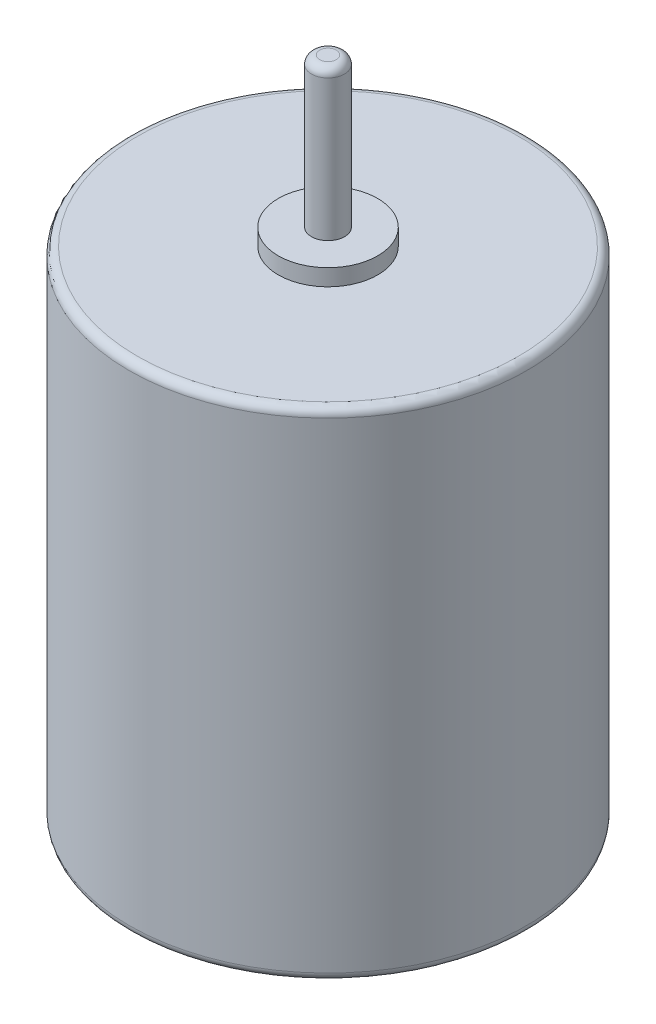
from build123d import *

# Parameters (mm, degrees)
SKETCH1_R                = 12
MOTOR_HOUSING_DEPTH      = 30
SKETCH2_R                = 3
MOTOR_FRONT_NIPPLE_DEPTH = 1
SKETCH4_R                = 1
FRONT_AXLE_DEPTH         = 9
FILLET1_R                = 0.5
FILLET2_R                = 0.5


with BuildPart() as part:
    # Sketch1 → Motor housing (new body)
    with BuildSketch(Plane(origin=(0, 0, 0), x_dir=(1, 0, 0), z_dir=(0, 1, 0))):
        Circle(SKETCH1_R)
    extrude(amount=MOTOR_HOUSING_DEPTH)

    # Sketch2 → Motor front nipple (add)
    with BuildSketch(Plane(origin=(0, 30, 0), x_dir=(1, 0, 0), z_dir=(0, 1, 0))):
        Circle(SKETCH2_R)
    extrude(amount=MOTOR_FRONT_NIPPLE_DEPTH)

    # Sketch4 → Front axle (add)
    with BuildSketch(Plane(origin=(0, 31, 0), x_dir=(1, 0, 0), z_dir=(0, 1, 0))):
        Circle(SKETCH4_R)
    extrude(amount=FRONT_AXLE_DEPTH)

    # Fillet1
    fillet1_edges = [part.edges().sort_by_distance(p)[0] for p in [
        (-1, 40, 0),
    ]]
    fillet(fillet1_edges, radius=FILLET1_R)

    # Fillet2
    fillet2_edges = [part.edges().sort_by_distance(p)[0] for p in [
        (-12, 0, 0),
        (-12, 30, 0),
    ]]
    fillet(fillet2_edges, radius=FILLET2_R)


solid = part.part
